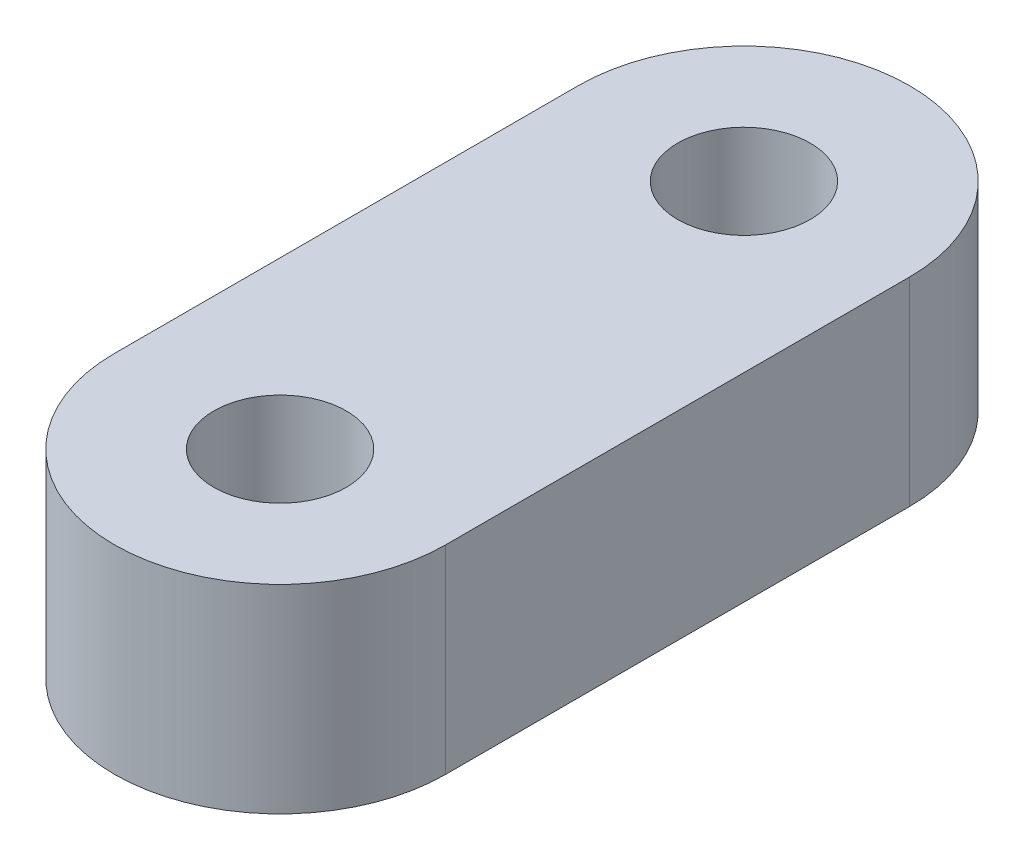
from build123d import *

# Parameters (mm, degrees)
CROQUIS1_R        = 1
BRIDA_BASE1_DEPTH = 3


# Sheet-metal steps are written as plain solids
with BuildPart() as part:
    # Croquis1 → Brida base1 (new body)
    with BuildSketch(Plane(origin=(0, 0, 0), x_dir=(1, 0, 0), z_dir=(0, 1, 0))):
        with BuildLine():
            Line((-2.5, -3.5), (-2.5, 3.5))
            ThreePointArc((-2.5, 3.5), (0, 6), (2.5, 3.5))
            Line((2.5, 3.5), (2.5, -3.5))
            ThreePointArc((2.5, -3.5), (0, -6), (-2.5, -3.5))
        make_face()
        with Locations(Location((0, 3.5, 0), (0, 0, 270))):
            Circle(CROQUIS1_R, mode=Mode.SUBTRACT)
        with Locations(Location((0, -3.5, 0), (0, 0, 270))):
            Circle(CROQUIS1_R, mode=Mode.SUBTRACT)
    extrude(amount=-BRIDA_BASE1_DEPTH)


solid = part.part
